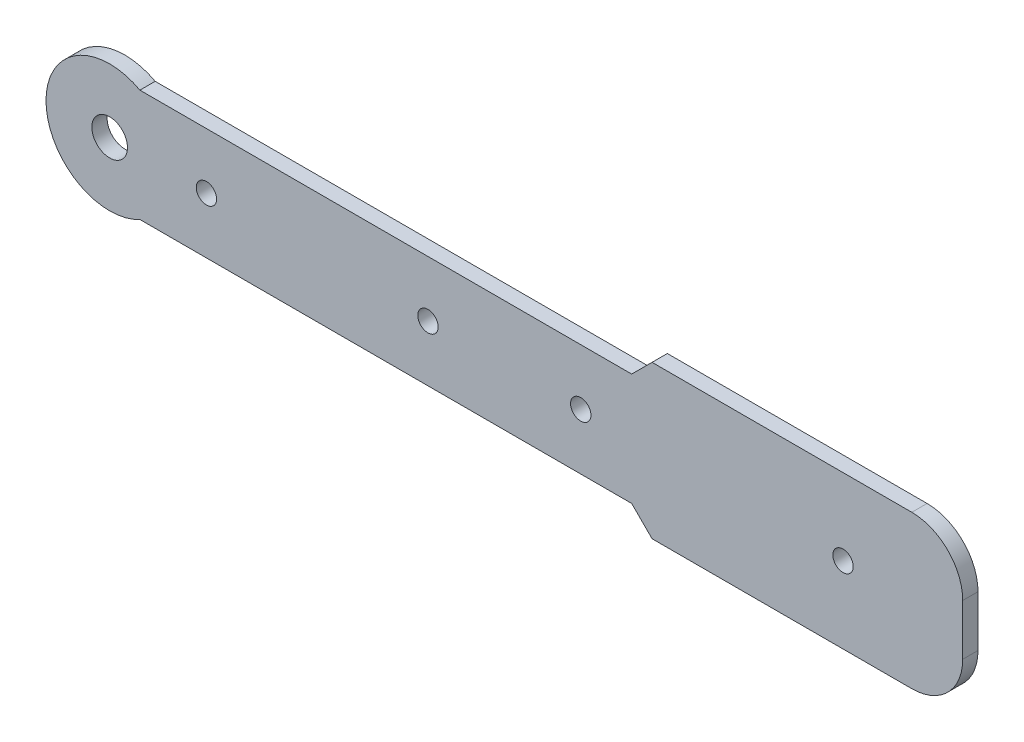
from build123d import *

# Parameters (mm, degrees)
SALIENTE_EXTRUIR1_DEPTH = 3
REDONDEO1_R             = 10
CHAFL_N1_SIZE           = 4
CORTAR_EXTRUIR2_REACH   = 93.291
CROQUIS3_R              = 3.5
CROQUIS3_R_2            = 2
CORTAR_EXTRUIR3_REACH   = 93.291
CROQUIS4_R              = 2
CORTAR_EXTRUIR4_REACH   = 93.291
CROQUIS2_R              = 2


with BuildPart() as part:
    # Croquis1 → Saliente-Extruir1 (new body)
    with BuildSketch(Plane.XY):
        with BuildLine():
            Line((90, -15), (90, 15))
            Line((90, 15), (25, 15))
            Line((25, 15), (25, 11))
            Line((25, 11), (-25, 11))
            Line((-25, 11), (-71.562828956, 11))
            ThreePointArc((-71.562828956, 11), (-90, 0), (-71.562828956, -11))
            Line((-71.562828956, -11), (-25, -11))
            Line((-25, -11), (25, -11))
            Line((25, -11), (25, -15))
            Line((25, -15), (90, -15))
        make_face()
    extrude(amount=SALIENTE_EXTRUIR1_DEPTH)

    # Redondeo1
    redondeo1_edges = [part.edges().sort_by_distance(p)[0] for p in [
        (90, 15, 1.5),
        (90, -15, 1.5),
    ]]
    fillet(redondeo1_edges, radius=REDONDEO1_R)

    # Chaflán1
    chafl_n1_edges = [part.edges().sort_by_distance(p)[0] for p in [
        (25, -15, 1.5),
        (25, 15, 1.5),
    ]]
    chamfer(chafl_n1_edges, length=CHAFL_N1_SIZE - 0.0001)  # a hair under: the kernel refuses the full size

    # Croquis3 → Cortar-Extruir2 (cut, up to next)
    with BuildSketch(Plane.XY.offset(3), mode=Mode.PRIVATE) as cortar_extruir2_sk1:
        with Locations((-77.5, 0)):
            Circle(CROQUIS3_R)
    cortar_extruir2_tool1 = extrude(cortar_extruir2_sk1.sketch, amount=-CORTAR_EXTRUIR2_REACH, mode=Mode.PRIVATE) & part.part
    # Croquis3 → Cortar-Extruir2 (cut, up to next)
    with BuildSketch(Plane.XY.offset(3), mode=Mode.PRIVATE) as cortar_extruir2_sk2:
        with Locations((-58.5, 0)):
            Circle(CROQUIS3_R_2)
    cortar_extruir2_tool2 = extrude(cortar_extruir2_sk2.sketch, amount=-CORTAR_EXTRUIR2_REACH, mode=Mode.PRIVATE) & part.part
    add(cortar_extruir2_tool1.solids().sort_by_distance((-77.5, 0, 3))[0], mode=Mode.SUBTRACT)
    add(cortar_extruir2_tool2.solids().sort_by_distance((-58.5, 0, 3))[0], mode=Mode.SUBTRACT)

    # Croquis4 → Cortar-Extruir3 (cut, up to next)
    with BuildSketch(Plane.XY.offset(3), mode=Mode.PRIVATE) as cortar_extruir3_sk1:
        with Locations((-15, 0)):
            Circle(CROQUIS4_R)
    cortar_extruir3_tool1 = extrude(cortar_extruir3_sk1.sketch, amount=-CORTAR_EXTRUIR3_REACH, mode=Mode.PRIVATE) & part.part
    # Croquis4 → Cortar-Extruir3 (cut, up to next)
    with BuildSketch(Plane.XY.offset(3), mode=Mode.PRIVATE) as cortar_extruir3_sk2:
        with Locations((15, 0)):
            Circle(CROQUIS4_R)
    cortar_extruir3_tool2 = extrude(cortar_extruir3_sk2.sketch, amount=-CORTAR_EXTRUIR3_REACH, mode=Mode.PRIVATE) & part.part
    add(cortar_extruir3_tool1.solids().sort_by_distance((-15, 0, 3))[0], mode=Mode.SUBTRACT)
    add(cortar_extruir3_tool2.solids().sort_by_distance((15, 0, 3))[0], mode=Mode.SUBTRACT)

    # Croquis2 → Cortar-Extruir4 (cut, up to next)
    with BuildSketch(Plane.XY.offset(3), mode=Mode.PRIVATE) as cortar_extruir4_sk1:
        with Locations((66.5, 0)):
            Circle(CROQUIS2_R)
    cortar_extruir4_tool1 = extrude(cortar_extruir4_sk1.sketch, amount=-CORTAR_EXTRUIR4_REACH, mode=Mode.PRIVATE) & part.part
    add(cortar_extruir4_tool1.solids().sort_by_distance((66.5, 0, 3))[0], mode=Mode.SUBTRACT)


solid = part.part
